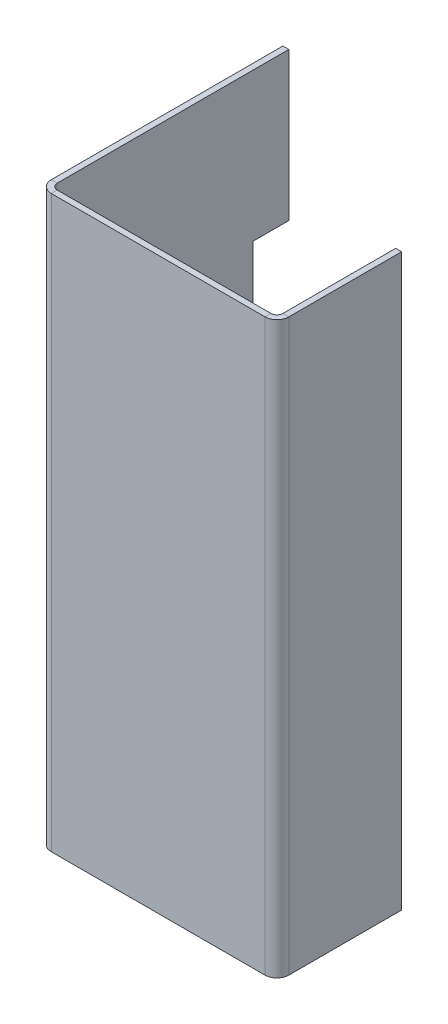
from build123d import *

# Parameters (mm, degrees)
SKETCH1_W                    = 63.5
SKETCH1_H                    = 152.4
BASE_FLANGE1_DEPTH           = 1.5875
EDGE_FLANGE1_STRIP_W         = 9.525
EDGE_FLANGE1_STRIP_H         = 1.5875
EDGE_FLANGE1_STRIP_CUT_DEPTH = 152.4
EDGE_FLANGE1_DEPTH           = 152.4
EDGE_FLANGE2_STRIP_W         = 9.525
EDGE_FLANGE2_STRIP_H         = 1.5875
EDGE_FLANGE2_STRIP_CUT_DEPTH = 152.4
EDGE_FLANGE2_DEPTH           = 152.4
F_4_CLEARANCE_HOLE1_REACH    = 120.638
F_4_CLEARANCE_HOLE1_BORE_R   = 1.63195
SKETCH16_W                   = 9.525
SKETCH16_H                   = 82.55
CUT_EXTRUDE1_DEPTH           = 118.796351015


# Sheet-metal steps are written as plain solids
with BuildPart() as part:
    # Sketch1 → Base-Flange1 (new body)
    with BuildSketch(Plane.XY):
        Rectangle(SKETCH1_W, SKETCH1_H)
    extrude(amount=-BASE_FLANGE1_DEPTH)

    # Edge-Flange1 strip (across the edge) → Edge-Flange1 strip cut (cut)
    with BuildSketch(Plane(origin=(31.75, 76.2, -1.5875), x_dir=(-1, 0, 0), z_dir=(0, -1, 0))):
        with Locations((-1.5875, -0.79375)):
            Rectangle(EDGE_FLANGE1_STRIP_W, EDGE_FLANGE1_STRIP_H)
    extrude(amount=EDGE_FLANGE1_STRIP_CUT_DEPTH, mode=Mode.SUBTRACT)

    # Edge-Flange1 section (across the edge) → Edge-Flange1 (add)
    with BuildSketch(Plane(origin=(31.75, 76.2, -1.5875), x_dir=(-1, 0, 0), z_dir=(0, -1, 0))):
        with BuildLine():
            Line((0, 1.5875), (0, 31.75))
            Line((0, 31.75), (1.5875, 31.75))
            Line((1.5875, 31.75), (1.5875, 1.5875))
            ThreePointArc((1.5875, 1.5875), (2.052467985, 0.464967985), (3.175, 0))
            Line((3.175, 0), (3.175, -1.5875))
            ThreePointArc((3.175, -1.5875), (0.92993597, -0.65756403), (0, 1.5875))
        make_face()
    extrude(amount=EDGE_FLANGE1_DEPTH)

    # Edge-Flange2 strip (across the edge) → Edge-Flange2 strip cut (cut)
    with BuildSketch(Plane(origin=(-31.75, -76.2, -1.5875), x_dir=(1, 0, 0), z_dir=(0, 1, 0))):
        with Locations((-1.5875, -0.79375)):
            Rectangle(EDGE_FLANGE2_STRIP_W, EDGE_FLANGE2_STRIP_H)
    extrude(amount=EDGE_FLANGE2_STRIP_CUT_DEPTH, mode=Mode.SUBTRACT)

    # Edge-Flange2 section (across the edge) → Edge-Flange2 (add)
    with BuildSketch(Plane(origin=(-31.75, -76.2, -1.5875), x_dir=(1, 0, 0), z_dir=(0, 1, 0))):
        with BuildLine():
            Line((0, 1.5875), (0, 63.5))
            Line((0, 63.5), (1.5875, 63.5))
            Line((1.5875, 63.5), (1.5875, 1.5875))
            ThreePointArc((1.5875, 1.5875), (2.052467985, 0.464967985), (3.175, 0))
            Line((3.175, 0), (3.175, -1.5875))
            ThreePointArc((3.175, -1.5875), (0.92993597, -0.65756403), (0, 1.5875))
        make_face()
    extrude(amount=EDGE_FLANGE2_DEPTH)

    # #4 Clearance Hole1 bore → #4 Clearance Hole1 (cut, up to next)
    with BuildSketch(Plane.ZY.offset(31.75), mode=Mode.PRIVATE) as f_4_clearance_hole1_sk1:
        with Locations((-9.525, -50.8)):
            Circle(F_4_CLEARANCE_HOLE1_BORE_R)
    f_4_clearance_hole1_tool1 = extrude(f_4_clearance_hole1_sk1.sketch, amount=-F_4_CLEARANCE_HOLE1_REACH, mode=Mode.PRIVATE) & part.part
    # #4 Clearance Hole1 bore → #4 Clearance Hole1 (cut, up to next)
    with BuildSketch(Plane.ZY.offset(31.75), mode=Mode.PRIVATE) as f_4_clearance_hole1_sk2:
        with Locations((-9.525, 0)):
            Circle(F_4_CLEARANCE_HOLE1_BORE_R)
    f_4_clearance_hole1_tool2 = extrude(f_4_clearance_hole1_sk2.sketch, amount=-F_4_CLEARANCE_HOLE1_REACH, mode=Mode.PRIVATE) & part.part
    # #4 Clearance Hole1 bore → #4 Clearance Hole1 (cut, up to next)
    with BuildSketch(Plane.ZY.offset(31.75), mode=Mode.PRIVATE) as f_4_clearance_hole1_sk3:
        with Locations((-9.525, 50.8)):
            Circle(F_4_CLEARANCE_HOLE1_BORE_R)
    f_4_clearance_hole1_tool3 = extrude(f_4_clearance_hole1_sk3.sketch, amount=-F_4_CLEARANCE_HOLE1_REACH, mode=Mode.PRIVATE) & part.part
    add(f_4_clearance_hole1_tool1.solids().sort_by_distance((-31.75, -50.8, -9.525))[0], mode=Mode.SUBTRACT)
    add(f_4_clearance_hole1_tool2.solids().sort_by_distance((-31.75, 0, -9.525))[0], mode=Mode.SUBTRACT)
    add(f_4_clearance_hole1_tool3.solids().sort_by_distance((-31.75, 50.8, -9.525))[0], mode=Mode.SUBTRACT)

    # Sketch16 → Cut-Extrude1 (cut, through all)
    with BuildSketch(Plane(origin=(-30.1625, 0, 0), x_dir=(0, 0, -1), z_dir=(1, 0, 0))):
        with Locations((60.325, -4.699)):
            Rectangle(SKETCH16_W, SKETCH16_H)
    extrude(amount=-CUT_EXTRUDE1_DEPTH, mode=Mode.SUBTRACT)


solid = part.part
